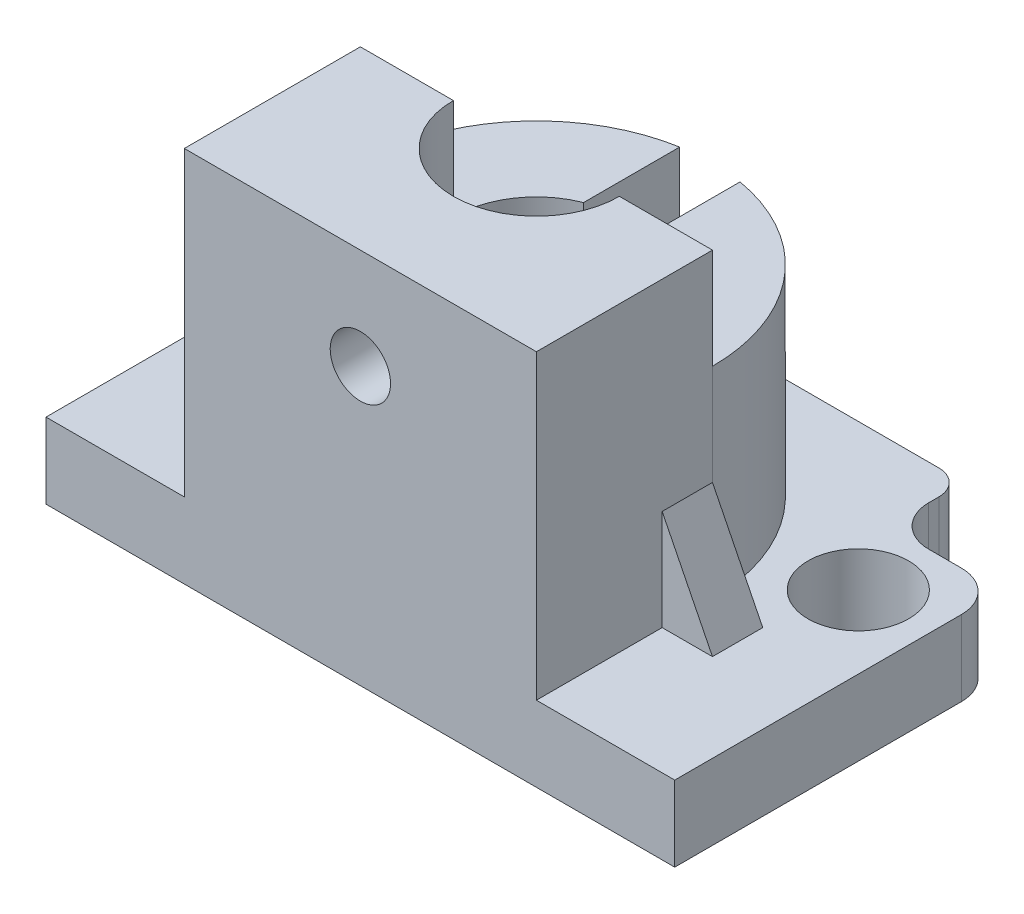
from build123d import *

# Parameters (mm, degrees)
SKETCH_1_R          = 10
EXTRUDE_1_DEPTH     = 15
FILLET_1_R          = 5
FILLET_2_R          = 8
SKETCH_3_R          = 16.5
EXTRUDE_2_DEPTH     = 60
RIB_1_REACH         = 111.687
SKETCH_4_WALL_W     = 243.73478946
SKETCH_4_WALL_H     = 10
SKETCH_5_W          = 80
SKETCH_5_H          = 40
CUT_EXTRUDE_1_DEPTH = 20
CUT_EXTRUDE_2_REACH = 111.687
SKETCH_6_W          = 12
SKETCH_6_H          = 15
CUT_EXTRUDE_3_REACH = 111.687
SKETCH_7_R          = 6
CUT_EXTRUDE_4_REACH = 119.925
SKETCH_3_2_R        = 16.5


with BuildPart() as part:
    # 草图1 → 凸台-拉伸1 (new body)
    with BuildSketch(Plane(origin=(0, 0, 0), x_dir=(1, 0, 0), z_dir=(0, 1, 0))):
        Polygon((-62.5, 65), (-62.5, 0), (62.5, 0), (62.5, 65), (40, 65), (40, 80), (-40, 80), (-40, 65), align=None)
        with Locations((-48, 51)):
            Circle(SKETCH_1_R, mode=Mode.SUBTRACT)
        with Locations((48, 51)):
            Circle(SKETCH_1_R, mode=Mode.SUBTRACT)
    extrude(amount=EXTRUDE_1_DEPTH)

    # 圆角1
    fillet_1_edges = [part.edges().sort_by_distance(p)[0] for p in [
        (40, 7.5, -80),
        (-40, 7.5, -80),
    ]]
    fillet(fillet_1_edges, radius=FILLET_1_R)

    # 圆角2
    fillet_2_edges = [part.edges().sort_by_distance(p)[0] for p in [
        (-62.5, 7.5, -65),
        (62.5, 7.5, -65),
        (-40, 7.5, -65),
        (40, 7.5, -65),
    ]]
    fillet(fillet_2_edges, radius=FILLET_2_R)

    # 草图3 → 凸台-拉伸2 (add)
    with BuildSketch(Plane(origin=(0, 15, 0), x_dir=(1, 0, 0), z_dir=(0, 1, 0))):
        with BuildLine():
            Line((-35, 0), (-35, 35))
            ThreePointArc((-35, 35), (0, 70), (35, 35))
            Line((35, 35), (35, 0))
            Line((35, 0), (-35, 0))
        make_face()
        with Locations((0, 35)):
            Circle(SKETCH_3_R, mode=Mode.SUBTRACT)
    extrude(amount=EXTRUDE_2_DEPTH)

    # 草图4 wall → 筋1 (add, up to next)
    with BuildSketch(Plane(origin=(-40, 25, -30), x_dir=(-0.4472135955, -0.894427191, 0), z_dir=(0.894427191, -0.4472135955, 0)), mode=Mode.PRIVATE) as rib_1_sk1:
        Rectangle(SKETCH_4_WALL_W, SKETCH_4_WALL_H)
    rib_1_tool1 = extrude(rib_1_sk1.sketch, amount=RIB_1_REACH, mode=Mode.PRIVATE) - part.part
    rib_1 = rib_1_tool1.solids().sort_by_distance((-40, 25, -30))[0]
    add(rib_1)

    # 镜向1: 筋1 across plane
    add(rib_1.mirror(Plane(origin=(0, 0, 0), x_dir=(0, 0, 1), z_dir=(1, 0, 0))))

    # 草图5 → 切除-拉伸1 (cut)
    with BuildSketch(Plane(origin=(0, 75, 0), x_dir=(1, 0, 0), z_dir=(0, 1, 0))):
        with Locations((0, 55)):
            Rectangle(SKETCH_5_W, SKETCH_5_H)
    extrude(amount=-CUT_EXTRUDE_1_DEPTH, mode=Mode.SUBTRACT)

    # 草图6 → 切除-拉伸2 (cut, up to next)
    with BuildSketch(Plane.XY.offset(-30), mode=Mode.PRIVATE) as cut_extrude_2_sk1:
        with Locations((0, 47.5)):
            Rectangle(SKETCH_6_W, SKETCH_6_H)
    cut_extrude_2_tool1 = extrude(cut_extrude_2_sk1.sketch, amount=-CUT_EXTRUDE_2_REACH, mode=Mode.PRIVATE) & part.part
    add(cut_extrude_2_tool1.solids().sort_by_distance((0, 47.5, -30))[0], mode=Mode.SUBTRACT)

    # 草图7 → 切除-拉伸3 (cut, up to next)
    with BuildSketch(Plane.XY.offset(-30), mode=Mode.PRIVATE) as cut_extrude_3_sk1:
        with Locations((0, 55)):
            Circle(SKETCH_7_R)
    cut_extrude_3_tool1 = extrude(cut_extrude_3_sk1.sketch, amount=CUT_EXTRUDE_3_REACH, mode=Mode.PRIVATE) & part.part
    add(cut_extrude_3_tool1.solids().sort_by_distance((0, 55, -30))[0], mode=Mode.SUBTRACT)

    # 草图3<2> → 切除-拉伸4 (cut, up to next)
    with BuildSketch(Plane(origin=(0, 15, 0), x_dir=(1, 0, 0), z_dir=(0, 1, 0)), mode=Mode.PRIVATE) as cut_extrude_4_sk1:
        with Locations((0, 35)):
            Circle(SKETCH_3_2_R)
    cut_extrude_4_tool1 = extrude(cut_extrude_4_sk1.sketch, amount=-CUT_EXTRUDE_4_REACH, mode=Mode.PRIVATE) & part.part
    add(cut_extrude_4_tool1.solids().sort_by_distance((0, 15, -35))[0], mode=Mode.SUBTRACT)


solid = part.part
